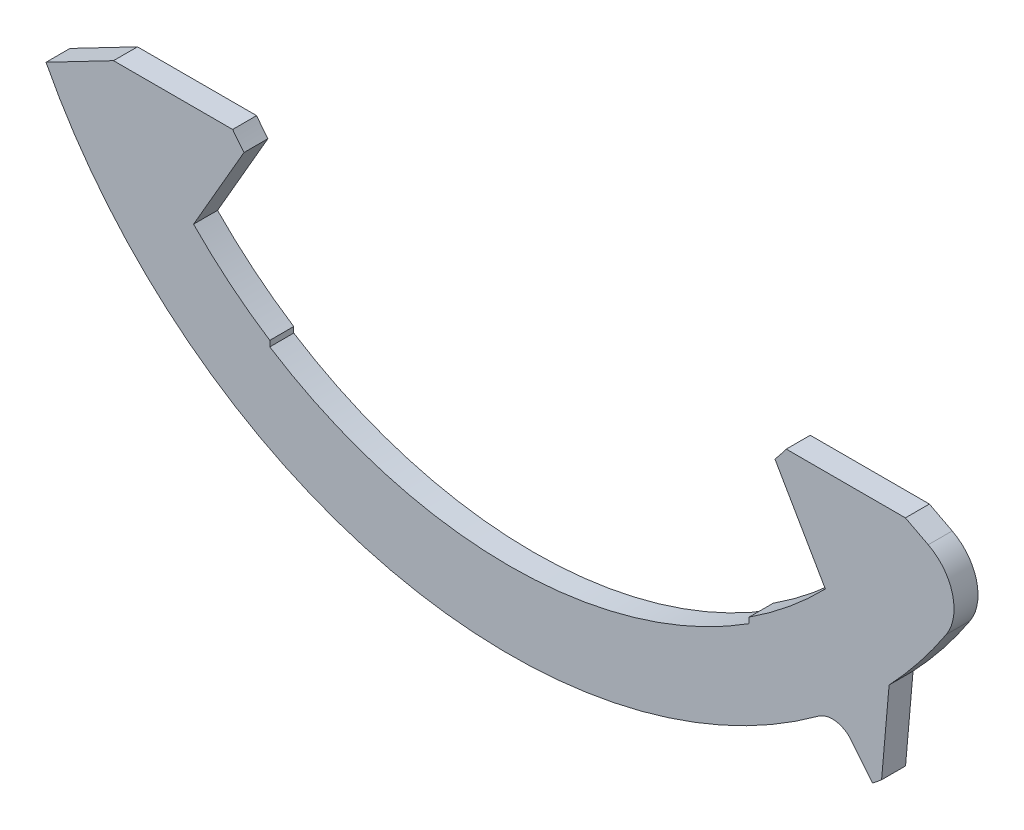
from build123d import *

# Parameters (mm, degrees)
OTHER_10076_5_DEPTH = 0.5
CUT_EXTRUDE1_START  = -0.5
CUT_EXTRUDE1_DEPTH  = 0.5


# Read off the part's stored shape, not the designer's step: 10076-5
with BuildPart() as part:
    # Other 10076-5 outline → Other 10076-5 (new body)
    with BuildSketch(Plane.XY):
        with BuildLine():
            ThreePointArc((7.573674013, -9.436602245), (7.668819519, -9.359444812), (7.763179028, -9.281328104))
            Line((7.763179028, -9.281328104), (7.919995926, -7.488902759))
            ThreePointArc((7.919995926, -7.488902759), (8.548470738, -6.76266575), (9.110578105, -5.983925684))
            ThreePointArc((9.110578105, -5.983925684), (9.242448569, -5.182849851), (8.736493865, -4.547930843))
            Line((8.736493865, -4.547930843), (8.260223146, -4.3))
            Line((8.260223146, -4.3), (5.774945887, -4.3))
            ThreePointArc((5.774945887, -4.3), (5.659072475, -4.451392897), (5.53923133, -4.5996648))
            Line((5.53923133, -4.5996648), (6.59, -6.419649523))
            ThreePointArc((6.59, -6.419649523), (5.831509763, -7.1157216), (5, -7.722693831))
            Line((5, -7.722693831), (5, -7.841555968))
            ThreePointArc((5, -7.841555968), (0, -9.3), (-5, -7.841555968))
            Line((-5, -7.841555968), (-5, -7.722693831))
            ThreePointArc((-5, -7.722693831), (-5.831509763, -7.1157216), (-6.59, -6.419649523))
            Line((-6.59, -6.419649523), (-5.53923133, -4.5996648))
            ThreePointArc((-5.53923133, -4.5996648), (-5.659072475, -4.451392897), (-5.774945887, -4.3))
            Line((-5.774945887, -4.3), (-8.260223146, -4.3))
            Line((-8.260223146, -4.3), (-10.732831081, -5.58715822))
            ThreePointArc((-10.732831081, -5.58715822), (-10.675718173, -5.6955282), (-10.617511084, -5.803314431))
            Line((-10.617511084, -5.803314431), (-9.055174855, -6.258693914))
            ThreePointArc((-9.055174855, -6.258693914), (-8.704696722, -6.64117368), (-8.882127626, -7.128661083))
            Line((-8.882127626, -7.128661083), (-9.436602245, -7.573674013))
            ThreePointArc((-9.436602245, -7.573674013), (-9.359444812, -7.668819519), (-9.281328104, -7.763179028))
            Line((-9.281328104, -7.763179028), (-7.660171598, -7.905011844))
            ThreePointArc((-7.660171598, -7.905011844), (-7.241809703, -8.211767477), (-7.320727248, -8.724502998))
            Line((-7.320727248, -8.724502998), (-7.777730077, -9.269137762))
            ThreePointArc((-7.777730077, -9.269137762), (-7.683493234, -9.347402405), (-7.588468891, -9.424709008))
            Line((-7.588468891, -9.424709008), (-5.970792243, -9.247544602))
            ThreePointArc((-5.970792243, -9.247544602), (-5.500623999, -9.466787654), (-5.477995427, -9.985067155))
            Line((-5.477995427, -9.985067155), (-5.819964104, -10.608393744))
            ThreePointArc((-5.819964104, -10.608393744), (-5.712269322, -10.666769858), (-5.603989074, -10.724052707))
            Line((-5.603989074, -10.724052707), (-4.05195869, -10.234699407))
            ThreePointArc((-4.05195869, -10.234699407), (-3.548052399, -10.358004491), (-3.424747314, -10.861910782))
            Line((-3.424747314, -10.861910782), (-3.638540174, -11.539975104))
            ThreePointArc((-3.638540174, -11.539975104), (-3.521526102, -11.576219327), (-3.404151099, -11.611277074))
            Line((-3.404151099, -11.611277074), (-1.977410637, -10.828540453))
            ThreePointArc((-1.977410637, -10.828540453), (-1.459131136, -10.851169025), (-1.239888083, -11.321337268))
            Line((-1.239888083, -11.321337268), (-1.317289186, -12.028081692))
            ThreePointArc((-1.317289186, -12.028081692), (-1.195452609, -12.04080118), (-1.073493507, -12.052286575))
            Line((-1.073493507, -12.052286575), (0.173128198, -11.006246762))
            ThreePointArc((0.173128198, -11.006246762), (0.685863719, -10.927329218), (0.992619352, -11.345691113))
            Line((0.992619352, -11.345691113), (1.054584487, -12.053955847))
            ThreePointArc((1.054584487, -12.053955847), (1.176561457, -12.042661796), (1.298417839, -12.030133462))
            Line((1.298417839, -12.030133462), (2.317013814, -10.760989181))
            ThreePointArc((2.317013814, -10.760989181), (2.804501216, -10.583558277), (3.186980982, -10.93403641))
            Line((3.186980982, -10.93403641), (3.38593107, -11.616603238))
            ThreePointArc((3.38593107, -11.616603238), (3.503360927, -11.581729673), (3.620431715, -11.545669067))
            Line((3.620431715, -11.545669067), (4.371857887, -10.10219282))
            ThreePointArc((4.371857887, -10.10219282), (4.815363304, -9.833067127), (5.258868721, -10.10219282))
            Line((5.258868721, -10.10219282), (5.58715822, -10.732831081))
            ThreePointArc((5.58715822, -10.732831081), (5.6955282, -10.675718173), (5.803314431, -10.617511084))
            Line((5.803314431, -10.617511084), (6.258693914, -9.055174855))
            ThreePointArc((6.258693914, -9.055174855), (6.64117368, -8.704696722), (7.128661083, -8.882127626))
            Line((7.128661083, -8.882127626), (7.573674013, -9.436602245))
        make_face()
    extrude(amount=OTHER_10076_5_DEPTH)

    # Sketch1 → Cut-Extrude1 (cut)
    with BuildSketch(Plane.XY.offset(0.5).offset(CUT_EXTRUDE1_START)):
        with BuildLine():
            Line((-9.668418082, -5.033059884), (-10.732831081, -5.58715822))
            ThreePointArc((-10.732831081, -5.58715822), (-3.521526102, -11.576219327), (5.803314431, -10.617511084))
            Line((5.803314431, -10.617511084), (6.258693914, -9.055174855))
            ThreePointArc((6.258693914, -9.055174855), (6.329177308, -8.908251896), (6.443160998, -8.791795969))
            ThreePointArc((6.443160998, -8.791795969), (-2.476407691, -10.614961373), (-9.668418082, -5.033059884))
        make_face()
    extrude(amount=CUT_EXTRUDE1_DEPTH, mode=Mode.SUBTRACT)


solid = part.part
